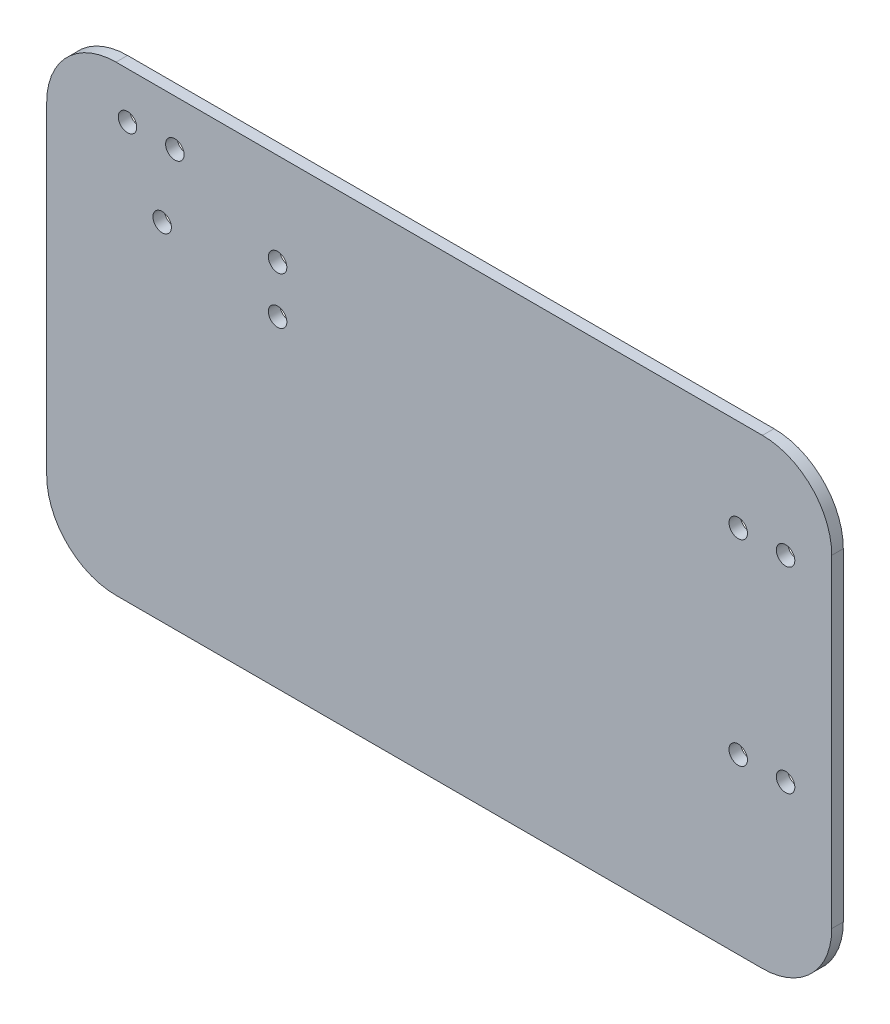
from build123d import *

# Parameters (mm, degrees)
CROQUIS1_R              = 4
SALIENTE_EXTRUIR1_DEPTH = 5


with BuildPart() as part:
    # Croquis1 → Saliente-Extruir1 (new body)
    with BuildSketch(Plane.XY):
        with BuildLine():
            Line((-125.472429705, -88.332065653), (154.527570295, -88.332065653))
            ThreePointArc((154.527570295, -88.332065653), (175.740773731, -79.545269088), (184.527570295, -58.332065653))
            Line((184.527570295, -58.332065653), (184.527570295, 81.667934347))
            ThreePointArc((184.527570295, 81.667934347), (175.740773731, 102.881137783), (154.527570295, 111.667934347))
            Line((154.527570295, 111.667934347), (-125.472429705, 111.667934347))
            ThreePointArc((-125.472429705, 111.667934347), (-146.68563314, 102.881137783), (-155.472429705, 81.667934347))
            Line((-155.472429705, 81.667934347), (-155.472429705, -58.332065653))
            ThreePointArc((-155.472429705, -58.332065653), (-146.68563314, -79.545269088), (-125.472429705, -88.332065653))
        make_face()
        with Locations((-105.472429705, 61.667934347)):
            Circle(CROQUIS1_R, mode=Mode.SUBTRACT)
        with Locations((-55.472429705, 71.667934347)):
            Circle(CROQUIS1_R, mode=Mode.SUBTRACT)
        with Locations((-55.472429705, 51.167934347)):
            Circle(CROQUIS1_R, mode=Mode.SUBTRACT)
        with Locations((144.027570295, -13.332065653)):
            Circle(CROQUIS1_R, mode=Mode.SUBTRACT)
        with Locations((164.527570295, -13.332065653)):
            Circle(CROQUIS1_R, mode=Mode.SUBTRACT)
        with Locations((144.027570295, 71.667934347)):
            Circle(CROQUIS1_R, mode=Mode.SUBTRACT)
        with Locations((164.527570295, 71.667934347)):
            Circle(CROQUIS1_R, mode=Mode.SUBTRACT)
        with Locations((-99.972429705, 91.667934347)):
            Circle(CROQUIS1_R, mode=Mode.SUBTRACT)
        with Locations((-120.472429705, 91.667934347)):
            Circle(CROQUIS1_R, mode=Mode.SUBTRACT)
    extrude(amount=SALIENTE_EXTRUIR1_DEPTH)


solid = part.part
